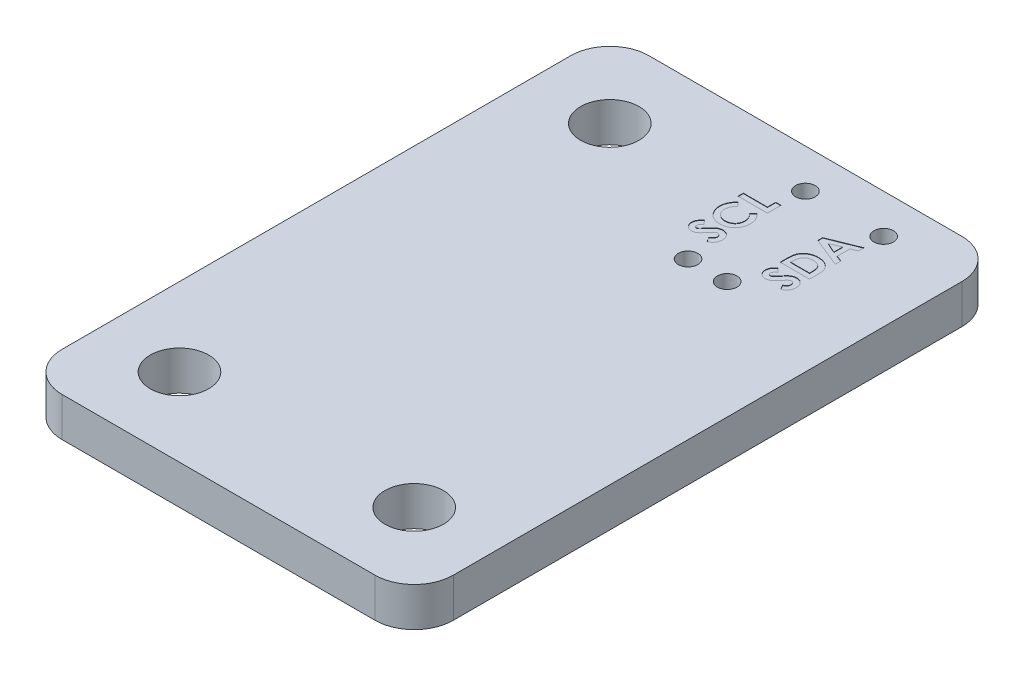
from build123d import *

# Parameters (mm, degrees)
SKETCH1_W             = 25.4
SKETCH1_H             = 38.1
BOSS_EXTRUDE1_DEPTH   = 1.27
FILLET1_R             = 2.54
SKETCH2_R             = 0.635
CUT_EXTRUDE1_DEPTH    = 24.035713577
CUT_EXTRUDE2_DEPTH    = 0.0254
F_6_CLEARANCE_HOLE1_D = 3.7973


with BuildPart() as part:
    # Sketch1 → Boss-Extrude1 (new, symmetric)
    with BuildSketch(Plane(origin=(0, 0, 0), x_dir=(1, 0, 0), z_dir=(0, 1, 0))):
        Rectangle(SKETCH1_W, SKETCH1_H)
    extrude(amount=BOSS_EXTRUDE1_DEPTH, both=True)

    # Fillet1
    fillet1_edges = [part.edges().sort_by_distance(p)[0] for p in [
        (-12.7, 0, -19.05),
        (12.7, 0, -19.05),
        (-12.7, 0, 19.05),
        (12.7, 0, 19.05),
    ]]
    fillet(fillet1_edges, radius=FILLET1_R)

    # Sketch2 → Cut-Extrude1 (cut, through all)
    with BuildSketch(Plane(origin=(0, 1.27, 0), x_dir=(1, 0, 0), z_dir=(0, 1, 0))):
        with Locations((7.62, 16.51)):
            Circle(SKETCH2_R)
        with Locations((2.54, 16.51)):
            Circle(SKETCH2_R)
        with Locations((5.08, 8.89)):
            Circle(SKETCH2_R)
        with Locations((2.54, 8.89)):
            Circle(SKETCH2_R)
    extrude(amount=-CUT_EXTRUDE1_DEPTH, mode=Mode.SUBTRACT)

    # Sketch4 → Cut-Extrude2 (cut)
    # profile 1 of 6: a face of its own
    with BuildSketch(Plane(origin=(0, 1.27, 0), x_dir=(1, 0, 0), z_dir=(0, 1, 0))):
        Polygon((0.635, 14.043269231), (0.635, 14.385192308), (2.198076923, 14.385192308), (2.198076923, 14.9225), (2.54, 14.9225), (2.54, 14.043269231), align=None)
    # profile 2 of 6: a face of its own
    with BuildSketch(Plane(origin=(0, 1.27, 0), x_dir=(1, 0, 0), z_dir=(0, 1, 0))):
        with BuildLine():
            Line((0.96547476, 13.701346154), (1.205126202, 13.450628005))
            add(Edge.make_bspline(
                [(1.205126202, 13.450628005), (1.183131289, 13.42936203), (1.140168334, 13.387822918), (1.083352096, 13.320853953), (1.035804478, 13.251386593), (0.996563531, 13.180114021), (0.96567754, 13.106896747), (0.943837754, 13.031489218), (0.93037445, 12.954001617), (0.928845795, 12.901544018), (0.928076923, 12.875159255)],
                knots=[0, 0, 0, 0, 1.115315123, 2.178559852, 3.196385012, 4.180486591, 5.141138664, 6.08807191, 7.038351522, 8, 8, 8, 8], degree=3))
            add(Edge.make_bspline(
                [(0.928076923, 12.875159255), (0.928686155, 12.853125605), (0.929888406, 12.809644624), (0.938723333, 12.745809184), (0.953690841, 12.684724133), (0.974495568, 12.626341011), (1.000695696, 12.570371163), (1.033627367, 12.517335768), (1.072191448, 12.466949809), (1.116320456, 12.419802005), (1.164891404, 12.377237735), (1.21604532, 12.338886724), (1.270686992, 12.307120848), (1.328019577, 12.281190399), (1.388063777, 12.260756609), (1.450816589, 12.246253929), (1.516419695, 12.237851066), (1.561017817, 12.236598254), (1.583683894, 12.235961538)],
                knots=[0, 0, 0, 0, 1.035268443, 2.04298821, 3.02163646, 3.985902049, 4.951223231, 5.920091634, 6.913651787, 7.92868536, 8.949353712, 9.945284791, 10.92850487, 11.913014323, 12.897904816, 13.904240668, 14.934873455, 16, 16, 16, 16], degree=3))
            add(Edge.make_bspline(
                [(1.583683894, 12.235961538), (1.599591986, 12.236147886), (1.630947161, 12.236515181), (1.677212389, 12.240426162), (1.722192295, 12.246939245), (1.765778776, 12.256012014), (1.808028745, 12.267642552), (1.849041134, 12.281077828), (1.888326952, 12.298238106), (1.926621777, 12.317114184), (1.963003772, 12.33883052), (1.997496891, 12.362609974), (2.030108855, 12.388233395), (2.060723706, 12.416042988), (2.088900724, 12.446388934), (2.115407129, 12.478538334), (2.139824812, 12.512810567), (2.161764937, 12.549219368), (2.182215459, 12.586662968), (2.199150459, 12.62591275), (2.214374206, 12.665870824), (2.225826999, 12.707238485), (2.235788522, 12.749286964), (2.241872331, 12.792601559), (2.246495222, 12.836771193), (2.246779845, 12.866623765), (2.246923077, 12.881646635)],
                knots=[0, 0, 0, 0, 1.103738238, 2.175490744, 3.219137561, 4.256155604, 5.262629953, 6.259184223, 7.247888397, 8.234817694, 9.220364322, 10.185094651, 11.140491148, 12.096499151, 13.05201798, 14.011605636, 14.986460005, 15.968997565, 16.960259839, 17.944382265, 18.933125845, 19.924977513, 20.920749559, 21.929466621, 22.958034467, 24, 24, 24, 24], degree=3))
            add(Edge.make_bspline(
                [(2.246923077, 12.881646635), (2.246188808, 12.907128838), (2.24474616, 12.957194741), (2.233382487, 13.03065613), (2.21488886, 13.100770371), (2.192418926, 13.15658893), (2.170631139, 13.20034633), (2.151044891, 13.233937571), (2.128465067, 13.268305016), (2.102797905, 13.303396325), (2.074155557, 13.339415174), (2.041978364, 13.375765501), (2.007306384, 13.413366232), (1.982561142, 13.437998556), (1.969873798, 13.450628005)],
                knots=[0, 0, 0, 0, 1.404693586, 2.759857621, 4.088769373, 5.395275838, 6.0697462, 6.783214465, 7.53810233, 8.336454657, 9.18000028, 10.074808326, 11.012918585, 12, 12, 12, 12], degree=3))
            Line((1.969873798, 13.450628005), (2.225171274, 13.693713942))
            add(Edge.make_bspline(
                [(2.225171274, 13.693713942), (2.241668847, 13.676626309), (2.273868582, 13.643274904), (2.319589201, 13.592965235), (2.360674259, 13.542718883), (2.398614965, 13.493749694), (2.432306013, 13.445255504), (2.461781051, 13.397241453), (2.487785546, 13.350251083), (2.509880944, 13.303308623), (2.528642231, 13.256121973), (2.544794469, 13.207572455), (2.55845868, 13.157511649), (2.569483905, 13.105633806), (2.578324646, 13.052422812), (2.584292096, 12.997380682), (2.588303813, 12.94085641), (2.588664299, 12.90251512), (2.588846154, 12.883173077)],
                knots=[0, 0, 0, 0, 1.244526981, 2.429050516, 3.560637417, 4.644440555, 5.67424972, 6.652764056, 7.595344123, 8.486817594, 9.369275933, 10.254498637, 11.166417451, 12.086725134, 13.032340136, 13.991389299, 14.986715468, 16, 16, 16, 16], degree=3))
            add(Edge.make_bspline(
                [(2.588846154, 12.883173077), (2.58794045, 12.847644139), (2.58616824, 12.778123883), (2.573037364, 12.676243761), (2.551023682, 12.57946038), (2.519890264, 12.487538284), (2.480118781, 12.400506702), (2.43136081, 12.318387899), (2.373745894, 12.241314234), (2.307949336, 12.169908308), (2.23528256, 12.10531825), (2.157258379, 12.048228119), (2.073493332, 12.00100316), (1.985224895, 11.961791259), (1.892050267, 11.931128069), (1.79386866, 11.909546381), (1.690774874, 11.896237111), (1.620359442, 11.894781058), (1.584447115, 11.894038462)],
                knots=[0, 0, 0, 0, 1.078019885, 2.10938526, 3.111377082, 4.085535484, 5.04941344, 6.010039228, 6.978205633, 7.964457913, 8.951525778, 9.924444315, 10.892603023, 11.863865945, 12.85144698, 13.863884204, 14.910567087, 16, 16, 16, 16], degree=3))
            add(Edge.make_bspline(
                [(1.584447115, 11.894038462), (1.56102484, 11.894349154), (1.514607614, 11.89496487), (1.446115664, 11.901557435), (1.379431924, 11.910511883), (1.315126232, 11.925221378), (1.252466619, 11.942321816), (1.192007587, 11.964353195), (1.13349446, 11.989949292), (1.077001138, 12.019175284), (1.023137675, 12.052649262), (0.971560565, 12.089093528), (0.922937935, 12.129391949), (0.877069321, 12.173136655), (0.83343518, 12.219923408), (0.793108621, 12.270553494), (0.755007779, 12.324163435), (0.720268968, 12.381124596), (0.688674618, 12.440139005), (0.661493156, 12.500919905), (0.638170466, 12.562683735), (0.61896881, 12.625617771), (0.60459699, 12.689833295), (0.593728563, 12.754900021), (0.587650748, 12.821364056), (0.586655992, 12.865989168), (0.586153846, 12.888515625)],
                knots=[0, 0, 0, 0, 1.071814294, 2.12407397, 3.147667899, 4.14936388, 5.141177959, 6.119239245, 7.091825145, 8.063277363, 9.028022524, 9.992609517, 10.952139039, 11.915934802, 12.892469547, 13.878248468, 14.87668965, 15.901326483, 16.93027266, 17.938917451, 18.9468897, 19.950817235, 20.948103127, 21.957084021, 22.968749718, 24, 24, 24, 24], degree=3))
            add(Edge.make_bspline(
                [(0.586153846, 12.888515625), (0.586441987, 12.907732895), (0.587015273, 12.945967628), (0.591785792, 13.002907131), (0.599299114, 13.059385026), (0.610555903, 13.115228846), (0.624188393, 13.170689718), (0.64097994, 13.225535443), (0.661461692, 13.279614781), (0.684118832, 13.333396558), (0.70991281, 13.385808176), (0.738784114, 13.436394142), (0.769977443, 13.485279801), (0.804029327, 13.532170451), (0.840439589, 13.577396366), (0.879207023, 13.620909288), (0.92103486, 13.662291679), (0.950586572, 13.688262184), (0.96547476, 13.701346154)],
                knots=[0, 0, 0, 0, 0.996333415, 1.982307736, 2.96084097, 3.949129141, 4.93457382, 5.921430247, 6.92116383, 7.931890485, 8.946633814, 9.948019707, 10.950686436, 11.952094051, 12.951305284, 13.960287133, 14.972390273, 16, 16, 16, 16], degree=3))
        make_face()
    # profile 3 of 6: a face of its own
    with BuildSketch(Plane(origin=(0, 1.27, 0), x_dir=(1, 0, 0), z_dir=(0, 1, 0))):
        with BuildLine():
            Line((0.889534255, 11.600961538), (1.123461538, 11.345282452))
            add(Edge.make_bspline(
                [(1.123461538, 11.345282452), (1.108012328, 11.334330256), (1.078351998, 11.313303568), (1.038636117, 11.279221499), (1.004755515, 11.245293328), (0.976851729, 11.211204731), (0.955094296, 11.17665356), (0.939689793, 11.141699791), (0.929897004, 11.106541586), (0.928677566, 11.082920699), (0.928076923, 11.071286058)],
                knots=[0, 0, 0, 0, 1.299362458, 2.494594718, 3.587462134, 4.587049575, 5.512617175, 6.380583204, 7.202344345, 8, 8, 8, 8], degree=3))
            add(Edge.make_bspline(
                [(0.928076923, 11.071286058), (0.928446202, 11.060428241), (0.929159182, 11.03946465), (0.936602781, 11.009718699), (0.948631236, 10.982986937), (0.965246628, 10.959981425), (0.985090227, 10.941473991), (1.006214707, 10.927083356), (1.029247346, 10.91872093), (1.045043532, 10.917647029), (1.052863582, 10.917115385)],
                knots=[0, 0, 0, 0, 1.184157716, 2.286297433, 3.324836695, 4.370048774, 5.362957217, 6.276446515, 7.146738784, 8, 8, 8, 8], degree=3))
            add(Edge.make_bspline(
                [(1.052863582, 10.917115385), (1.060792729, 10.917451915), (1.07676093, 10.91812964), (1.100164318, 10.924675543), (1.123032152, 10.934542089), (1.136952891, 10.943969975), (1.14406851, 10.948789063)],
                knots=[0, 0, 0, 0, 0.967525499, 1.948461899, 2.951351359, 4, 4, 4, 4], degree=3))
            add(Edge.make_bspline(
                [(1.14406851, 10.948789063), (1.14958362, 10.953187157), (1.16235203, 10.963369488), (1.182879988, 10.982212913), (1.207143561, 11.00681793), (1.235646893, 11.036573077), (1.268660607, 11.071374554), (1.305633235, 11.111761906), (1.346205187, 11.158030217), (1.374808208, 11.190482522), (1.389825721, 11.207521034)],
                knots=[0, 0, 0, 0, 0.473854981, 1.097054127, 1.870604305, 2.795416232, 3.865517794, 5.093525133, 6.47400653, 8, 8, 8, 8], degree=3))
            add(Edge.make_bspline(
                [(1.389825721, 11.207521034), (1.403690264, 11.223549275), (1.430002287, 11.253967546), (1.467409393, 11.297191853), (1.500912608, 11.33542615), (1.530762815, 11.36832271), (1.555730744, 11.39686456), (1.577352457, 11.419789359), (1.594682097, 11.438078243), (1.605161204, 11.448464185), (1.609633413, 11.452896635)],
                knots=[0, 0, 0, 0, 1.543627419, 2.929484142, 4.163674036, 5.24627963, 6.164986907, 6.925413438, 7.541394495, 8, 8, 8, 8], degree=3))
            add(Edge.make_bspline(
                [(1.609633413, 11.452896635), (1.62783516, 11.469713196), (1.662825308, 11.502040532), (1.717035306, 11.544080412), (1.769908626, 11.578528408), (1.822309345, 11.605488778), (1.875447343, 11.625663101), (1.93046862, 11.63979693), (1.987790936, 11.64839046), (2.02683126, 11.649331647), (2.046577524, 11.649807692)],
                knots=[0, 0, 0, 0, 1.206593015, 2.319495511, 3.336910718, 4.276265636, 5.184178927, 6.099356736, 7.038670786, 8, 8, 8, 8], degree=3))
            add(Edge.make_bspline(
                [(2.046577524, 11.649807692), (2.065817165, 11.649466694), (2.103566056, 11.648797644), (2.158805937, 11.64060306), (2.211672894, 11.628918061), (2.26159169, 11.610851013), (2.309381617, 11.588830966), (2.354298665, 11.561225793), (2.39679588, 11.528806794), (2.43611941, 11.491651584), (2.471785624, 11.450546253), (2.503599811, 11.406483557), (2.529657782, 11.358863853), (2.551974212, 11.308635575), (2.567854996, 11.254881695), (2.580348906, 11.198581907), (2.587668605, 11.139151039), (2.588447982, 11.098527417), (2.588846154, 11.077773438)],
                knots=[0, 0, 0, 0, 1.043169307, 2.046737005, 3.02462096, 3.976528701, 4.921503154, 5.875710796, 6.831116189, 7.817539083, 8.805892356, 9.780872653, 10.7604363, 11.74661763, 12.757588865, 13.796088471, 14.874055702, 16, 16, 16, 16], degree=3))
            add(Edge.make_bspline(
                [(2.588846154, 11.077773438), (2.588557325, 11.06148056), (2.587985278, 11.029211318), (2.583308372, 10.981652878), (2.575776761, 10.935723915), (2.564924384, 10.891503647), (2.551361264, 10.848646107), (2.534046674, 10.807569062), (2.514141874, 10.76797731), (2.49121917, 10.729952234), (2.464581168, 10.693733621), (2.435270654, 10.658306457), (2.401867687, 10.624837706), (2.365020783, 10.59257731), (2.32450396, 10.561941566), (2.280932031, 10.531884523), (2.23348193, 10.503754091), (2.200195884, 10.486376227), (2.183194111, 10.4775)],
                knots=[0, 0, 0, 0, 1.016956594, 2.014157282, 2.980233409, 3.920138626, 4.854357287, 5.783465618, 6.699725051, 7.61900777, 8.551402113, 9.504102091, 10.486778735, 11.499758944, 12.559144124, 13.656050795, 14.802762778, 16, 16, 16, 16], degree=3))
            Line((2.183194111, 10.4775), (2.002692308, 10.778209135))
            add(Edge.make_bspline(
                [(2.002692308, 10.778209135), (2.021991598, 10.789311916), (2.058989987, 10.810596896), (2.108702012, 10.846666286), (2.151272133, 10.883617534), (2.185947919, 10.92230492), (2.213193031, 10.962258021), (2.232664279, 11.003669818), (2.244716959, 11.046569408), (2.246188869, 11.07579066), (2.246923077, 11.090366587)],
                knots=[0, 0, 0, 0, 1.283663364, 2.460892379, 3.537111102, 4.529833553, 5.449777664, 6.316464042, 7.160231139, 8, 8, 8, 8], degree=3))
            add(Edge.make_bspline(
                [(2.246923077, 11.090366587), (2.246323483, 11.105192391), (2.245160184, 11.133956611), (2.234415142, 11.175013854), (2.217544638, 11.21265669), (2.193472755, 11.245194878), (2.165690143, 11.272746165), (2.134780716, 11.293080596), (2.101337464, 11.305854823), (2.07810558, 11.307205368), (2.066421274, 11.307884615)],
                knots=[0, 0, 0, 0, 1.13588714, 2.203786484, 3.234766741, 4.283437687, 5.291419208, 6.222934724, 7.106237994, 8, 8, 8, 8], degree=3))
            add(Edge.make_bspline(
                [(2.066421274, 11.307884615), (2.055550929, 11.307257359), (2.033468862, 11.305983146), (2.000636381, 11.296597693), (1.967818831, 11.281925366), (1.940900989, 11.264566968), (1.918363409, 11.246902625), (1.898835616, 11.230011529), (1.877260823, 11.209442643), (1.853611891, 11.185248119), (1.827680632, 11.157747631), (1.799469586, 11.126918013), (1.769227259, 11.092406233), (1.748626484, 11.068013239), (1.737854567, 11.055258413)],
                knots=[0, 0, 0, 0, 0.916159276, 1.861089862, 2.860218735, 3.940849679, 4.552606315, 5.27541173, 6.11797699, 7.06649574, 8.129236253, 9.306560635, 10.591630461, 12, 12, 12, 12], degree=3))
            add(Edge.make_bspline(
                [(1.737854567, 11.055258413), (1.71733893, 11.031010962), (1.677963212, 10.984472763), (1.619806285, 10.918708706), (1.565454118, 10.859448268), (1.514231285, 10.807208228), (1.467094986, 10.761307019), (1.423626763, 10.722105622), (1.383520473, 10.689814125), (1.335698814, 10.656295772), (1.277942998, 10.624062723), (1.208500067, 10.596151917), (1.138996035, 10.578214091), (1.092270703, 10.576189029), (1.069272837, 10.575192308)],
                knots=[0, 0, 0, 0, 1.345561566, 2.582539916, 3.71901348, 4.751744315, 5.681651107, 6.506005906, 7.230637833, 7.861516384, 8.978504332, 10.023243174, 11.027054763, 12, 12, 12, 12], degree=3))
            add(Edge.make_bspline(
                [(1.069272837, 10.575192308), (1.052963256, 10.575605534), (1.02083163, 10.576419635), (0.973586629, 10.583681287), (0.927999664, 10.594534698), (0.884234739, 10.610294782), (0.84235531, 10.63075738), (0.802123533, 10.655578765), (0.763961749, 10.685340088), (0.727494576, 10.718452769), (0.694510296, 10.755375552), (0.665413354, 10.794667263), (0.640705003, 10.836155579), (0.620870881, 10.88000035), (0.60512651, 10.925843459), (0.594096948, 10.973800724), (0.587502468, 11.023782051), (0.586608988, 11.057782333), (0.586153846, 11.075102163)],
                knots=[0, 0, 0, 0, 1.010608097, 1.99100651, 2.956992389, 3.912457524, 4.868345712, 5.842283282, 6.837666818, 7.864758285, 8.892394644, 9.901925088, 10.892014243, 11.880216914, 12.880338321, 13.892361018, 14.926363314, 16, 16, 16, 16], degree=3))
            add(Edge.make_bspline(
                [(0.586153846, 11.075102163), (0.586974919, 11.097547372), (0.588610582, 11.142260613), (0.60140156, 11.208370114), (0.621515072, 11.272944386), (0.645784969, 11.324975464), (0.669283486, 11.366385277), (0.690952879, 11.398092733), (0.715681808, 11.430545356), (0.744167244, 11.463240817), (0.77547485, 11.496972794), (0.810326291, 11.531242932), (0.848363039, 11.566416287), (0.875570098, 11.589244728), (0.889534255, 11.600961538)],
                knots=[0, 0, 0, 0, 1.282949271, 2.555771389, 3.837399776, 5.142782039, 5.830402679, 6.558840402, 7.337330299, 8.162747002, 9.037840561, 9.968992266, 10.957575255, 12, 12, 12, 12], degree=3))
        make_face()
    # profile 4 of 6: a face of its own
    with BuildSketch(Plane(origin=(0, 1.27, 0), x_dir=(1, 0, 0), z_dir=(0, 1, 0))):
        Polygon((5.715, 14.141343149), (5.715, 14.458461538), (7.62, 15.227788462), (7.62, 14.862587139), (7.229230769, 14.714522236), (7.229230769, 13.884519231), (7.62, 13.736454327), (7.62, 13.371634615), align=None)
        Polygon((6.225976562, 14.299711538), (6.887307692, 14.014266827), (6.887307692, 14.58515625), align=None, mode=Mode.SUBTRACT)
    # profile 5 of 6: a face of its own
    with BuildSketch(Plane(origin=(0, 1.27, 0), x_dir=(1, 0, 0), z_dir=(0, 1, 0))):
        with BuildLine():
            Line((5.715, 11.698653846), (5.715, 12.129492188))
            add(Edge.make_bspline(
                [(5.715, 12.129492188), (5.715229365, 12.163081815), (5.715672731, 12.228010945), (5.7208598, 12.322067025), (5.728475946, 12.409592921), (5.740134953, 12.490389264), (5.753658327, 12.564751589), (5.771799054, 12.632115829), (5.792484193, 12.692970454), (5.816887738, 12.747906491), (5.84532476, 12.798060075), (5.877005012, 12.845681909), (5.913084716, 12.890679273), (5.95286897, 12.933683423), (5.997085299, 12.974139439), (6.045001407, 13.012721042), (6.09731212, 13.048483584), (6.152763198, 13.082508089), (6.211589637, 13.113278725), (6.273290717, 13.140118025), (6.33746937, 13.162601468), (6.404193993, 13.180870431), (6.47324308, 13.195432902), (6.544755968, 13.20562197), (6.618666445, 13.211920953), (6.668759205, 13.212559932), (6.69421274, 13.212884615)],
                knots=[0, 0, 0, 0, 1.443572968, 2.79044287, 4.047742841, 5.218390556, 6.298195001, 7.294187071, 8.214052338, 9.058415274, 9.873579163, 10.689402867, 11.514245497, 12.34988967, 13.204999844, 14.087904451, 14.991805053, 15.926675376, 16.882870032, 17.842731001, 18.816259901, 19.80313118, 20.814314197, 21.847329874, 22.906167961, 24, 24, 24, 24], degree=3))
            add(Edge.make_bspline(
                [(6.69421274, 13.212884615), (6.730129336, 13.212034419), (6.800833256, 13.210360759), (6.904590445, 13.196262777), (7.004052059, 13.173461567), (7.098440071, 13.141400995), (7.186913941, 13.101654468), (7.267913473, 13.054172791), (7.341003888, 12.999652155), (7.405821312, 12.938727733), (7.461532613, 12.872761406), (7.509245803, 12.804209148), (7.54686975, 12.732402874), (7.570734706, 12.669132139), (7.585563042, 12.614267006), (7.594373183, 12.566101083), (7.602234859, 12.511352498), (7.609256791, 12.44965822), (7.613936683, 12.381024321), (7.617213788, 12.305439185), (7.619636228, 12.223001984), (7.619875566, 12.165747111), (7.62, 12.135979567)],
                knots=[0, 0, 0, 0, 1.315448733, 2.589537832, 3.828572084, 5.048874227, 6.235690825, 7.376293813, 8.481764604, 9.569767924, 10.627792487, 11.639989165, 12.623927547, 13.589954798, 14.111118089, 14.704320463, 15.382530461, 16.137544902, 16.978618851, 17.902349489, 18.90940453, 20, 20, 20, 20], degree=3))
            Line((7.62, 12.135979567), (7.62, 11.698653846))
            Line((7.62, 11.698653846), (5.715, 11.698653846))
        make_face()
        with BuildLine():
            Line((6.056923077, 12.040576923), (7.278076923, 12.040576923))
            Line((7.278076923, 12.040576923), (7.278076923, 12.219170673))
            add(Edge.make_bspline(
                [(7.278076923, 12.219170673), (7.27797404, 12.240416902), (7.277776192, 12.281274286), (7.275057783, 12.340335169), (7.270643409, 12.394840331), (7.264113886, 12.444861167), (7.256257198, 12.49051267), (7.24653951, 12.531628317), (7.234722062, 12.568289146), (7.220795079, 12.600797477), (7.20489434, 12.630476866), (7.186327179, 12.65797242), (7.165693174, 12.684508979), (7.142404143, 12.709596097), (7.116763388, 12.733327159), (7.088640204, 12.75556219), (7.058120005, 12.776597848), (7.025041534, 12.795894221), (6.989754074, 12.813527348), (6.952599447, 12.829169909), (6.91326823, 12.842139899), (6.872128612, 12.852919761), (6.828822427, 12.860623195), (6.783670436, 12.866996317), (6.736493752, 12.870281847), (6.704393159, 12.870732766), (6.688106971, 12.870961538)],
                knots=[0, 0, 0, 0, 1.502695833, 2.889746668, 4.180916226, 5.369476429, 6.456726991, 7.456222963, 8.355346258, 9.177624335, 9.954596642, 10.733182277, 11.52153258, 12.330160087, 13.151502329, 13.990398686, 14.863901178, 15.771270193, 16.696748626, 17.652564526, 18.61995629, 19.623816541, 20.657945923, 21.72937045, 22.847999446, 24, 24, 24, 24], degree=3))
            add(Edge.make_bspline(
                [(6.688106971, 12.870961538), (6.66314936, 12.870507535), (6.614483953, 12.869622262), (6.543611188, 12.86103152), (6.476957396, 12.847189328), (6.414693801, 12.82702508), (6.356424569, 12.802228328), (6.302900569, 12.770698739), (6.253244487, 12.73435174), (6.224119976, 12.705592907), (6.209567308, 12.691222957)],
                knots=[0, 0, 0, 0, 1.138242922, 2.219485503, 3.251901297, 4.239342788, 5.201071, 6.134757343, 7.067992642, 8, 8, 8, 8], degree=3))
            add(Edge.make_bspline(
                [(6.209567308, 12.691222957), (6.197166046, 12.677054005), (6.171837873, 12.648115527), (6.141488245, 12.597309067), (6.114823122, 12.541322981), (6.093680652, 12.478876473), (6.076960287, 12.410573061), (6.065428659, 12.336005929), (6.058018558, 12.255574401), (6.05729606, 12.199853312), (6.056923077, 12.17108774)],
                knots=[0, 0, 0, 0, 0.813307809, 1.661089106, 2.549956539, 3.493439533, 4.508053171, 5.589449661, 6.755572447, 8, 8, 8, 8], degree=3))
            Line((6.056923077, 12.17108774), (6.056923077, 12.040576923))
        make_face(mode=Mode.SUBTRACT)
    # profile 6 of 6: a face of its own
    with BuildSketch(Plane(origin=(0, 1.27, 0), x_dir=(1, 0, 0), z_dir=(0, 1, 0))):
        with BuildLine():
            Line((5.969534255, 11.307884615), (6.203461538, 11.052205529))
            add(Edge.make_bspline(
                [(6.203461538, 11.052205529), (6.188012328, 11.041253333), (6.158351998, 11.020226645), (6.118636117, 10.986144576), (6.084755515, 10.952216405), (6.056851729, 10.918127808), (6.035094296, 10.883576637), (6.019689793, 10.848622868), (6.009897004, 10.813464663), (6.008677566, 10.789843776), (6.008076923, 10.778209135)],
                knots=[0, 0, 0, 0, 1.299362458, 2.494594718, 3.587462134, 4.587049575, 5.512617175, 6.380583204, 7.202344345, 8, 8, 8, 8], degree=3))
            add(Edge.make_bspline(
                [(6.008076923, 10.778209135), (6.008446202, 10.767351318), (6.009159182, 10.746387727), (6.016602781, 10.716641776), (6.028631236, 10.689910014), (6.045246628, 10.666904502), (6.065090227, 10.648397068), (6.086214707, 10.634006433), (6.109247346, 10.625644007), (6.125043532, 10.624570106), (6.132863582, 10.624038462)],
                knots=[0, 0, 0, 0, 1.184157716, 2.286297433, 3.324836695, 4.370048774, 5.362957217, 6.276446515, 7.146738784, 8, 8, 8, 8], degree=3))
            add(Edge.make_bspline(
                [(6.132863582, 10.624038462), (6.140792729, 10.624374992), (6.15676093, 10.625052717), (6.180164318, 10.63159862), (6.203032152, 10.641465166), (6.216952891, 10.650893052), (6.22406851, 10.655712139)],
                knots=[0, 0, 0, 0, 0.967525499, 1.948461899, 2.951351359, 4, 4, 4, 4], degree=3))
            add(Edge.make_bspline(
                [(6.22406851, 10.655712139), (6.22958362, 10.660110234), (6.24235203, 10.670292565), (6.262879988, 10.68913599), (6.287143561, 10.713741007), (6.315646893, 10.743496154), (6.348660607, 10.778297631), (6.385633235, 10.818684983), (6.426205187, 10.864953294), (6.454808208, 10.897405599), (6.469825721, 10.914444111)],
                knots=[0, 0, 0, 0, 0.473854981, 1.097054127, 1.870604305, 2.795416232, 3.865517794, 5.093525133, 6.47400653, 8, 8, 8, 8], degree=3))
            add(Edge.make_bspline(
                [(6.469825721, 10.914444111), (6.483690264, 10.930472351), (6.510002287, 10.960890623), (6.547409393, 11.00411493), (6.580912608, 11.042349227), (6.610762815, 11.075245787), (6.635730744, 11.103787637), (6.657352457, 11.126712436), (6.674682097, 11.14500132), (6.685161204, 11.155387262), (6.689633413, 11.159819712)],
                knots=[0, 0, 0, 0, 1.543627419, 2.929484142, 4.163674036, 5.24627963, 6.164986907, 6.925413438, 7.541394495, 8, 8, 8, 8], degree=3))
            add(Edge.make_bspline(
                [(6.689633413, 11.159819712), (6.70783516, 11.176636273), (6.742825308, 11.208963609), (6.797035306, 11.251003489), (6.849908626, 11.285451485), (6.902309345, 11.312411855), (6.955447343, 11.332586178), (7.01046862, 11.346720007), (7.067790936, 11.355313537), (7.10683126, 11.356254724), (7.126577524, 11.356730769)],
                knots=[0, 0, 0, 0, 1.206593015, 2.319495511, 3.336910718, 4.276265636, 5.184178927, 6.099356736, 7.038670786, 8, 8, 8, 8], degree=3))
            add(Edge.make_bspline(
                [(7.126577524, 11.356730769), (7.145817165, 11.356389771), (7.183566056, 11.355720721), (7.238805937, 11.347526137), (7.291672894, 11.335841138), (7.34159169, 11.31777409), (7.389381617, 11.295754042), (7.434298665, 11.26814887), (7.47679588, 11.235729871), (7.51611941, 11.198574661), (7.551785624, 11.15746933), (7.583599811, 11.113406634), (7.609657782, 11.06578693), (7.631974212, 11.015558652), (7.647854996, 10.961804772), (7.660348906, 10.905504984), (7.667668605, 10.846074116), (7.668447982, 10.805450494), (7.668846154, 10.784696514)],
                knots=[0, 0, 0, 0, 1.043169307, 2.046737005, 3.02462096, 3.976528701, 4.921503154, 5.875710796, 6.831116189, 7.817539083, 8.805892356, 9.780872653, 10.7604363, 11.74661763, 12.757588865, 13.796088471, 14.874055702, 16, 16, 16, 16], degree=3))
            add(Edge.make_bspline(
                [(7.668846154, 10.784696514), (7.668557325, 10.768403637), (7.667985278, 10.736134395), (7.663308372, 10.688575955), (7.655776761, 10.642646992), (7.644924384, 10.598426724), (7.631361264, 10.555569184), (7.614046674, 10.514492139), (7.594141874, 10.474900387), (7.57121917, 10.436875311), (7.544581168, 10.400656698), (7.515270654, 10.365229534), (7.481867687, 10.331760783), (7.445020783, 10.299500387), (7.40450396, 10.268864643), (7.360932031, 10.2388076), (7.31348193, 10.210677168), (7.280195884, 10.193299304), (7.263194111, 10.184423077)],
                knots=[0, 0, 0, 0, 1.016956594, 2.014157282, 2.980233409, 3.920138626, 4.854357287, 5.783465618, 6.699725051, 7.61900777, 8.551402113, 9.504102091, 10.486778735, 11.499758944, 12.559144124, 13.656050795, 14.802762778, 16, 16, 16, 16], degree=3))
            Line((7.263194111, 10.184423077), (7.082692308, 10.485132212))
            add(Edge.make_bspline(
                [(7.082692308, 10.485132212), (7.101991598, 10.496234993), (7.138989987, 10.517519973), (7.188702012, 10.553589363), (7.231272133, 10.590540611), (7.265947919, 10.629227997), (7.293193031, 10.669181098), (7.312664279, 10.710592895), (7.324716959, 10.753492485), (7.326188869, 10.782713736), (7.326923077, 10.797289663)],
                knots=[0, 0, 0, 0, 1.283663364, 2.460892379, 3.537111102, 4.529833553, 5.449777664, 6.316464042, 7.160231139, 8, 8, 8, 8], degree=3))
            add(Edge.make_bspline(
                [(7.326923077, 10.797289663), (7.326323483, 10.812115468), (7.325160184, 10.840879688), (7.314415142, 10.881936931), (7.297544638, 10.919579767), (7.273472755, 10.952117955), (7.245690143, 10.979669242), (7.214780716, 11.000003673), (7.181337464, 11.0127779), (7.15810558, 11.014128445), (7.146421274, 11.014807692)],
                knots=[0, 0, 0, 0, 1.13588714, 2.203786484, 3.234766741, 4.283437687, 5.291419208, 6.222934724, 7.106237994, 8, 8, 8, 8], degree=3))
            add(Edge.make_bspline(
                [(7.146421274, 11.014807692), (7.135550929, 11.014180436), (7.113468862, 11.012906223), (7.080636381, 11.00352077), (7.047818831, 10.988848443), (7.020900989, 10.971490045), (6.998363409, 10.953825702), (6.978835616, 10.936934606), (6.957260823, 10.91636572), (6.933611891, 10.892171196), (6.907680632, 10.864670708), (6.879469586, 10.83384109), (6.849227259, 10.79932931), (6.828626484, 10.774936316), (6.817854567, 10.76218149)],
                knots=[0, 0, 0, 0, 0.916159276, 1.861089862, 2.860218735, 3.940849679, 4.552606315, 5.27541173, 6.11797699, 7.06649574, 8.129236253, 9.306560635, 10.591630461, 12, 12, 12, 12], degree=3))
            add(Edge.make_bspline(
                [(6.817854567, 10.76218149), (6.79733893, 10.737934039), (6.757963212, 10.69139584), (6.699806285, 10.625631783), (6.645454118, 10.566371345), (6.594231285, 10.514131305), (6.547094986, 10.468230096), (6.503626763, 10.429028699), (6.463520473, 10.396737202), (6.415698814, 10.363218849), (6.357942998, 10.3309858), (6.288500067, 10.303074994), (6.218996035, 10.285137168), (6.172270703, 10.283112106), (6.149272837, 10.282115385)],
                knots=[0, 0, 0, 0, 1.345561566, 2.582539916, 3.71901348, 4.751744315, 5.681651107, 6.506005906, 7.230637833, 7.861516384, 8.978504332, 10.023243174, 11.027054763, 12, 12, 12, 12], degree=3))
            add(Edge.make_bspline(
                [(6.149272837, 10.282115385), (6.132963256, 10.282528611), (6.10083163, 10.283342712), (6.053586629, 10.290604364), (6.007999664, 10.301457775), (5.964234739, 10.317217859), (5.92235531, 10.337680457), (5.882123533, 10.362501842), (5.843961749, 10.392263165), (5.807494576, 10.425375846), (5.774510296, 10.462298629), (5.745413354, 10.50159034), (5.720705003, 10.543078656), (5.700870881, 10.586923427), (5.68512651, 10.632766535), (5.674096948, 10.680723801), (5.667502468, 10.730705128), (5.666608988, 10.76470541), (5.666153846, 10.78202524)],
                knots=[0, 0, 0, 0, 1.010608097, 1.99100651, 2.956992389, 3.912457524, 4.868345712, 5.842283282, 6.837666818, 7.864758285, 8.892394644, 9.901925088, 10.892014243, 11.880216914, 12.880338321, 13.892361018, 14.926363314, 16, 16, 16, 16], degree=3))
            add(Edge.make_bspline(
                [(5.666153846, 10.78202524), (5.666974919, 10.804470449), (5.668610582, 10.84918369), (5.68140156, 10.915293191), (5.701515072, 10.979867463), (5.725784969, 11.031898541), (5.749283486, 11.073308354), (5.770952879, 11.10501581), (5.795681808, 11.137468433), (5.824167244, 11.170163894), (5.85547485, 11.203895871), (5.890326291, 11.238166009), (5.928363039, 11.273339364), (5.955570098, 11.296167805), (5.969534255, 11.307884615)],
                knots=[0, 0, 0, 0, 1.282949271, 2.555771389, 3.837399776, 5.142782039, 5.830402679, 6.558840402, 7.337330299, 8.162747002, 9.037840561, 9.968992266, 10.957575255, 12, 12, 12, 12], degree=3))
        make_face()
    extrude(amount=-CUT_EXTRUDE2_DEPTH, mode=Mode.SUBTRACT)

    # #6 Clearance Hole1 (through all)
    with Locations(Plane(origin=(0, 1.27, 0), x_dir=(1, 0, 0), z_dir=(0, 1, 0))):
        with Locations((-7.62, 13.97), (-7.62, -13.97), (7.62, -13.97)):
            Hole(F_6_CLEARANCE_HOLE1_D / 2)


solid = part.part
